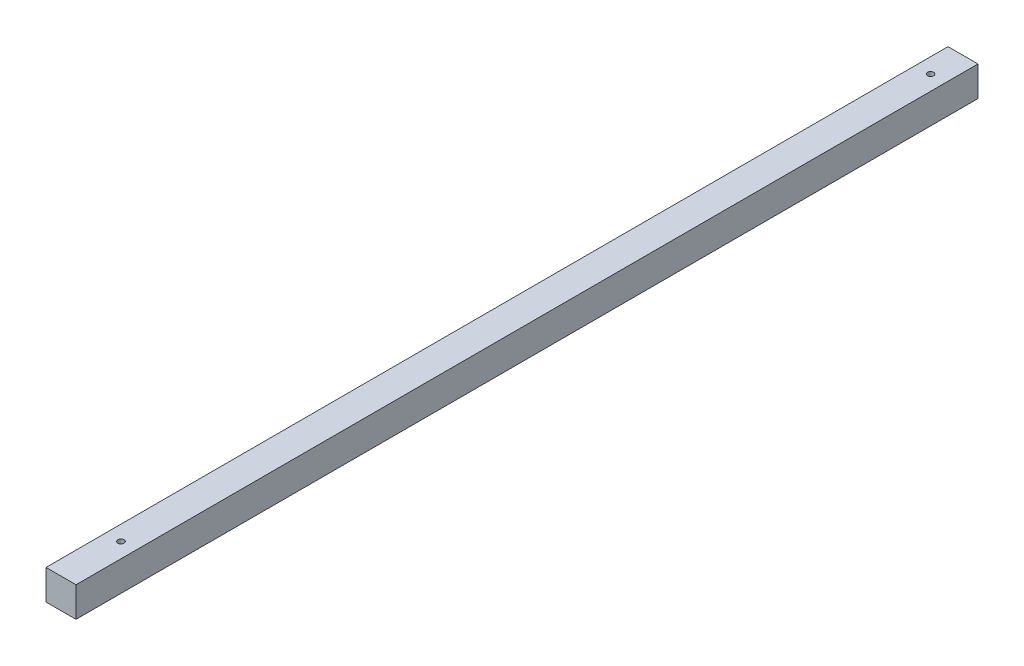
from build123d import *

# Parameters (mm, degrees)
ESQUISSE1_W             = 10
ESQUISSE1_H             = 10
BOSS_EXTRU_1_DEPTH      = 300.81
ESQUISSE2_R             = 1.025
ENL_V_MAT_EXTRU_1_DEPTH = 302.142252266
ESQUISSE3_R             = 1.025
ENL_V_MAT_EXTRU_2_DEPTH = 302.142252266


with BuildPart() as part:
    # Esquisse1 → Boss.-Extru.1 (new body)
    with BuildSketch(Plane.XY):
        with Locations((5, 5)):
            Rectangle(ESQUISSE1_W, ESQUISSE1_H)
    extrude(amount=BOSS_EXTRU_1_DEPTH)

    # Esquisse2 → Enlèv. mat.-Extru.1 (cut, through all)
    with BuildSketch(Plane(origin=(0, 10, 0), x_dir=(1, 0, 0), z_dir=(0, 1, 0))):
        with Locations((5, -10.81)):
            Circle(ESQUISSE2_R)
    extrude(amount=-ENL_V_MAT_EXTRU_1_DEPTH, mode=Mode.SUBTRACT)

    # Esquisse3 → Enlèv. mat.-Extru.2 (cut, through all)
    with BuildSketch(Plane(origin=(0, 10, 0), x_dir=(1, 0, 0), z_dir=(0, 1, 0))):
        with Locations((5, -280.81)):
            Circle(ESQUISSE3_R)
    extrude(amount=-ENL_V_MAT_EXTRU_2_DEPTH, mode=Mode.SUBTRACT)


solid = part.part
